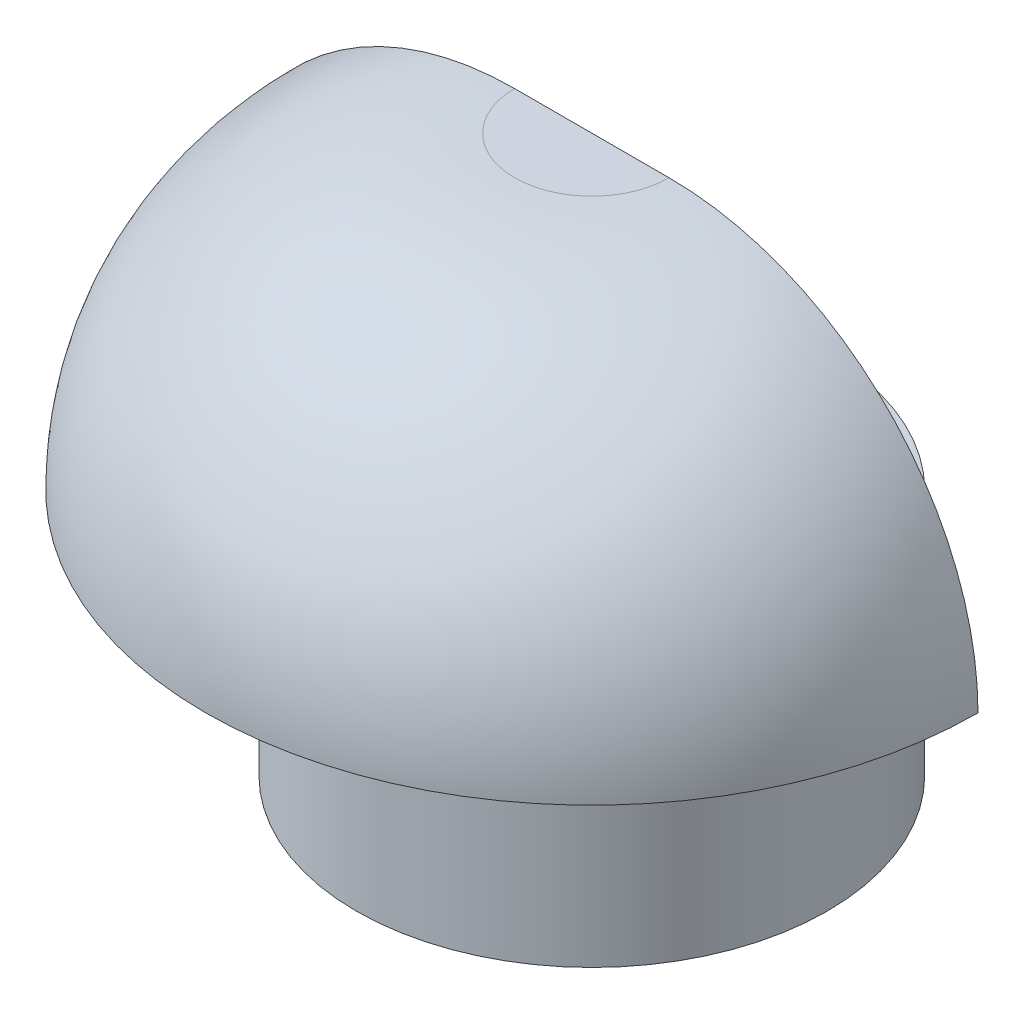
from build123d import *

# Parameters (mm, degrees)
BOSS_EXTRUDE1_DEPTH = 18
FILLET1_R           = 10
CUT_EXTRUDE1_DEPTH  = 8
BOSS_EXTRUDE2_DEPTH = 8


with BuildPart() as part:
    # Sketch1 → Boss-Extrude1 (new body)
    with BuildSketch(Plane(origin=(0, 0, 0), x_dir=(1, 0, 0), z_dir=(0, 1, 0))):
        with BuildLine():
            Line((-12.5, 0), (12.5, 0))
            ThreePointArc((12.5, 0), (0, -12.5), (-12.5, 0))
        make_face()
    extrude(amount=BOSS_EXTRUDE1_DEPTH)

    # Fillet1
    fillet1_edges = [part.edges().sort_by_distance(p)[0] for p in [
        (0, 18, 12.5),
    ]]
    fillet(fillet1_edges, radius=FILLET1_R)

    # Sketch2 → Cut-Extrude1 (cut)
    with BuildSketch(Plane.XZ):
        with BuildLine():
            Line((-12.5, 0), (-7.62, 0))
            ThreePointArc((-7.62, 0), (0, 7.62), (7.62, 0))
            Line((7.62, 0), (12.5, 0))
            ThreePointArc((12.5, 0), (0, 12.5), (-12.5, 0))
        make_face()
    extrude(amount=-CUT_EXTRUDE1_DEPTH, mode=Mode.SUBTRACT)

    # Sketch4 → Boss-Extrude2 (add)
    with BuildSketch(Plane.XZ):
        with BuildLine():
            Line((-7.62, 0), (7.62, 0))
            ThreePointArc((7.62, 0), (0, -7.62), (-7.62, 0))
        make_face()
    extrude(amount=-BOSS_EXTRUDE2_DEPTH)


solid = part.part
